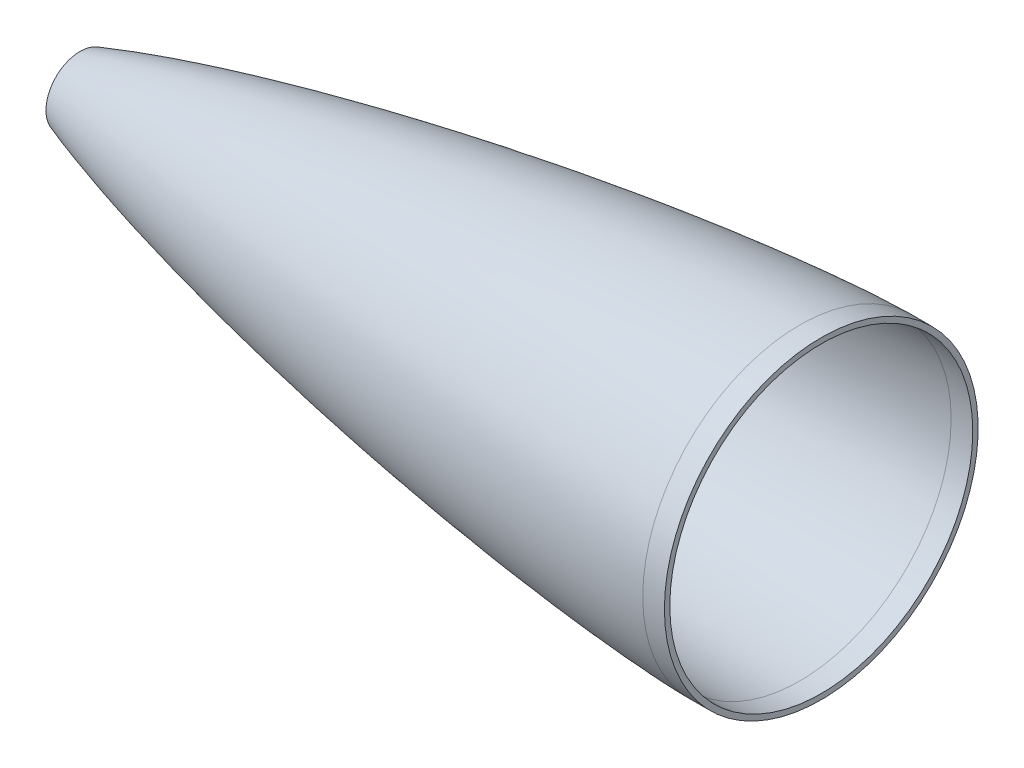
from build123d import *

# Parameters (mm, degrees)
SKETCH2_R          = 92.074999981
CUT_EXTRUDE1_DEPTH = 38.1


with BuildPart() as part:
    # Sketch1 → Revolve3 (revolve)
    with BuildSketch(Plane.XY):
        with BuildLine():
            Line((457.2, 88.899999981), (469.892985607, 88.899999981))
            Line((469.892985607, 88.899999981), (469.892985607, 92.074999981))
            Line((469.892985607, 92.074999981), (457.192985607, 92.074999981))
            add(Edge.make_bspline(
                [(-3.233533197, 0), (-3.233119572, 0.002144237), (-3.225399709, 0.042163705), (-3.210373167, 0.120060435), (-3.188460539, 0.233658361), (-3.170178631, 0.328421048), (-3.155601067, 0.404011965), (-3.144536838, 0.461304203), (-3.135733517, 0.507142246), (-3.127755899, 0.548086327), (-3.124898856, 0.563945006), (-3.117737439, 0.59891883), (-3.124386526, 0.569925954), (-3.092722892, 0.721762714), (-3.063014556, 0.841858197), (-3.000644224, 1.05764884), (-2.910843994, 1.289138606), (-2.840045141, 1.44417966), (-2.7787319, 1.56764454), (-2.703170178, 1.708108209), (-2.620471452, 1.848234313), (-2.528077119, 1.992117765), (-2.359553692, 2.236618939), (-2.142965187, 2.508952282), (-1.881714665, 2.802525962), (-1.637521292, 3.053715464), (-1.324166051, 3.355454819), (-0.948394619, 3.688623839), (-0.510079684, 4.048681713), (0.066293953, 4.494076568), (0.775692846, 5.002428819), (1.622848845, 5.567051871), (2.466243005, 6.097618677), (3.310774165, 6.604259191), (4.437508456, 7.252822731), (5.847548081, 8.022373735), (7.546909329, 8.89917443), (9.25129179, 9.737917373), (11.530017619, 10.815587734), (14.392585704, 12.099976595), (17.844314576, 13.563300495), (22.465044134, 15.432449628), (28.273136776, 17.641758236), (35.278691246, 20.142620994), (42.315932297, 22.524188844), (51.732462878, 25.565027267), (63.554370673, 29.155652305), (77.805197286, 33.203129942), (92.10671226, 37.033845217), (106.450602357, 40.679731362), (120.830278369, 44.163070849), (140.045286875, 48.612230489), (164.133512064, 53.839382691), (193.130424558, 59.646078265), (222.205867316, 65.026536132), (251.350995085, 70.004314793), (280.560024559, 74.589102307), (309.829120195, 78.779052885), (339.156305457, 82.559603598), (368.541429322, 85.899655612), (393.079509236, 88.270578193), (412.743747628, 89.865042726), (427.513401365, 90.884701641), (439.837101283, 91.554929689), (448.492887504, 91.890271874), (453.437748051, 92.025893346), (455.94392917, 92.069480979), (457.192985607, 92.074999981)],
                knots=[-0.001302768, -0.001302768, -0.001302768, -0.001302768, -0.001288833, -0.001042691, -0.00079655, -0.000550408, -0.000427337, -0.000304266, -0.000181196, -0.00011966, -5.8125e-05, -2.7357e-05, 3.41e-06, 1.8794e-05, 3.4178e-05, 6.4946e-05, 0.000126481, 0.000188017, 0.000249552, 0.000311087, 0.000434158, 0.000557229, 0.0006803, 0.001172583, 0.001664866, 0.002157149, 0.002649432, 0.003633998, 0.004618564, 0.005603131, 0.007572263, 0.009541395, 0.011510528, 0.01347966, 0.015448792, 0.019387057, 0.023325322, 0.027263586, 0.031201851, 0.039078381, 0.04695491, 0.054831439, 0.070584498, 0.086337557, 0.102090616, 0.117843675, 0.149349793, 0.18085591, 0.212362028, 0.243868146, 0.275374263, 0.306880381, 0.369892617, 0.432904852, 0.495917087, 0.558929323, 0.621941558, 0.684953794, 0.747966029, 0.810978265, 0.8739905, 0.905496618, 0.937002735, 0.968508853, 0.984261912, 0.992138441, 1.000014971, 1.000014971, 1.000014971, 1.000014971], degree=3))
            Line((-3.233533197, 0), (0, 0))
            add(Edge.make_bspline(
                [(0, 0), (0.002252326, 0.011676015), (0.008172498, 0.034601551), (0.025924078, 0.07868817), (0.069515821, 0.163009702), (0.133891919, 0.263104421), (0.219083202, 0.377874193), (0.336980112, 0.520691984), (0.508294819, 0.709916231), (0.796743276, 0.996314892), (1.297392915, 1.436984627), (2.171427967, 2.115548405), (3.700669892, 3.156129635), (6.415913097, 4.768274854), (11.136159186, 7.198190988), (18.882543075, 10.659186), (32.161816521, 15.828571543), (51.229171373, 22.241878784), (75.23036556, 29.337949289), (102.988289697, 36.657803249), (131.619753695, 43.511950241), (160.374510852, 49.827259848), (189.22769389, 55.674239309), (218.163982111, 61.094544577), (247.172465418, 66.113329232), (276.245797951, 70.741694957), (305.378606257, 74.979662903), (334.567274001, 78.814730666), (363.809388761, 82.21995637), (389.441934274, 84.779668607), (411.445236254, 86.618046199), (428.63351735, 87.774473661), (439.738528717, 88.370701031), (448.426307528, 88.718662985), (453.439289178, 88.851920429), (455.946335944, 88.89446062), (457.2, 88.899999981)],
                knots=[0, 0, 0, 0, 0, 0.000101175, 0.000202351, 0.000404702, 0.000809403, 0.00111569, 0.001421978, 0.001985248, 0.002987861, 0.004583917, 0.007112661, 0.011425968, 0.018769715, 0.031526477, 0.052412239, 0.083827717, 0.14038342, 0.203214574, 0.266045748, 0.328876912, 0.391708076, 0.454539237, 0.517370407, 0.580201572, 0.643032736, 0.705863901, 0.768695068, 0.831526236, 0.894357403, 0.925772984, 0.957188566, 0.978594283, 0.989297141, 1, 1, 1, 1, 1], degree=4))
        make_face()
    revolve(axis=Axis((0, 0, 0), (1, 0, 0)))

    # Sketch2 → Cut-Extrude1 (cut)
    with BuildSketch(Plane(origin=(-3.233533201, 0, 0), x_dir=(0, 0, -1), z_dir=(1, 0, 0))):
        Circle(SKETCH2_R)
    extrude(amount=CUT_EXTRUDE1_DEPTH, mode=Mode.SUBTRACT)


solid = part.part
